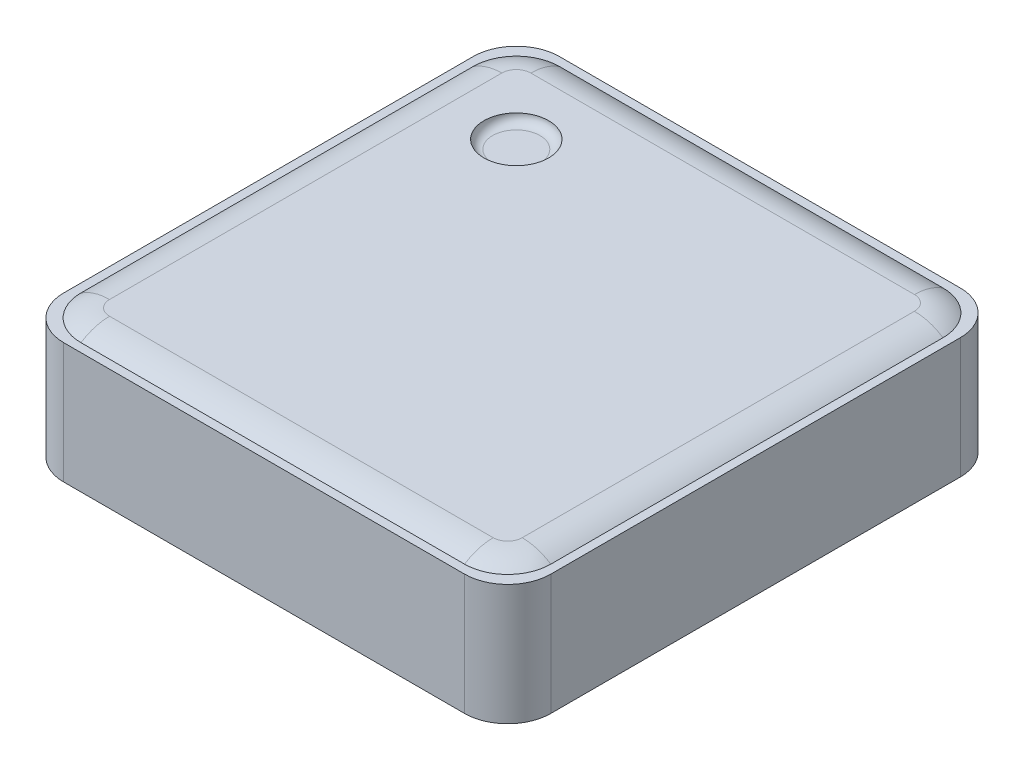
from build123d import *

# Parameters (mm, degrees)
ESBO_O1_W                = 113
ESBO_O1_H                = 115
RESSALTO_EXTRUS_O1_DEPTH = 30
ESBO_O2_W                = 113
ESBO_O2_H                = 115
ESBO_O2_W_2              = 109
ESBO_O2_H_2              = 111
CORTE_EXTRUS_O1_DEPTH    = 2
FILETE1_R                = 10
FILETE2_R                = 12
ESBO_O3_R                = 7.5
CORTE_EXTRUS_O2_DEPTH    = 2
FILETE3_R                = 2


# Some blends are built 0.0001 mm under size
with BuildPart() as part:
    # Esboço1 → Ressalto-extrusão1 (new body)
    with BuildSketch(Plane(origin=(0, 0, 0), x_dir=(1, 0, 0), z_dir=(0, 1, 0))):
        Rectangle(ESBO_O1_W, ESBO_O1_H)
    extrude(amount=RESSALTO_EXTRUS_O1_DEPTH)

    # Esboço2 → Corte-extrusão1 (cut)
    with BuildSketch(Plane(origin=(0, 30, 0), x_dir=(1, 0, 0), z_dir=(0, 1, 0))):
        Rectangle(ESBO_O2_W, ESBO_O2_H)
        Rectangle(ESBO_O2_W_2, ESBO_O2_H_2, mode=Mode.SUBTRACT)
    extrude(amount=-CORTE_EXTRUS_O1_DEPTH, mode=Mode.SUBTRACT)

    # Filete1
    filete1_edges = [part.edges().sort_by_distance(p)[0] for p in [
        (-56.5, 14, -57.5),
        (56.5, 14, -57.5),
        (56.5, 14, 57.5),
        (-56.5, 14, 57.5),
        (54.5, 29, 55.5),
        (-54.5, 29, 55.5),
        (-54.5, 29, -55.5),
        (54.5, 29, -55.5),
    ]]
    fillet(filete1_edges, radius=FILETE1_R)

    # Filete2
    # the kernel refuses this fillet: 12 mm, written as the material it takes off along each edge
    with BuildSketch(Plane(origin=(44.5, 30, 55.5), x_dir=(0, -1, 0), z_dir=(-1, 0, 0)), Plane(origin=(-44.5, 30, -55.5), x_dir=(0, -1, 0), z_dir=(1, 0, 0))) as filete2_piece_1:
        with BuildLine():
            CenterArc((12, -6.633249581), FILETE2_R, 146.442690238, 33.557309762)
            Line((0, -6.633249581), (-0.24, -6.633249581))
            Line((-0.24, -6.633249581), (-0.24, 0))
            Line((-0.24, 0), (0, 0.24))
            ThreePointArc((0, 0.24), (1, 0.24), (1.8, 0.132664992))
            Line((1.8, 0.132664992), (2, 0))
        make_face()
    extrude(amount=89, mode=Mode.SUBTRACT)
    with BuildSketch(Plane(origin=(-54.5, 30, 45.5), x_dir=(0, -1, 0), z_dir=(0, 0, -1)), Plane(origin=(54.5, 30, -45.5), x_dir=(0, -1, 0), z_dir=(0, 0, 1))) as filete2_piece_2:
        with BuildLine():
            CenterArc((12, -6.633249581), FILETE2_R, 146.442690238, 33.557309762)
            Line((0, -6.633249581), (-0.24, -6.633249581))
            Line((-0.24, -6.633249581), (-0.24, 0))
            Line((-0.24, 0), (0, 0.24))
            ThreePointArc((0, 0.24), (1, 0.24), (1.8, 0.132664992))
            Line((1.8, 0.132664992), (2, 0))
        make_face()
    extrude(amount=91, mode=Mode.SUBTRACT)
    with BuildSketch(Plane(origin=(44.5, 30, -45.5), x_dir=(1, 0, 0), z_dir=(0, 0, 1))) as filete2_piece_3:
        with BuildLine():
            CenterArc((3.366750419, -12), FILETE2_R, 56.442690238, 33.557309762)
            Line((3.366750419, 0), (3.366750419, 0.24))
            Line((3.366750419, 0.24), (10, 0.24))
            Line((10, 0.24), (10.24, 0))
            ThreePointArc((10.24, 0), (10.24, -1), (10.132664992, -1.8))
            Line((10.132664992, -1.8), (10, -2))
        make_face()
    revolve(axis=Axis((44.5, 30, -45.5), (0, 1, 0)), revolution_arc=90, mode=Mode.SUBTRACT)
    with BuildSketch(Plane(origin=(44.5, 30, 45.5), x_dir=(0, 0, 1), z_dir=(-1, 0, 0))) as filete2_piece_4:
        with BuildLine():
            CenterArc((3.366750419, -12), FILETE2_R, 56.442690238, 33.557309762)
            Line((3.366750419, 0), (3.366750419, 0.24))
            Line((3.366750419, 0.24), (10, 0.24))
            Line((10, 0.24), (10.24, 0))
            ThreePointArc((10.24, 0), (10.24, -1), (10.132664992, -1.8))
            Line((10.132664992, -1.8), (10, -2))
        make_face()
    revolve(axis=Axis((44.5, 30, 45.5), (0, 1, 0)), revolution_arc=90, mode=Mode.SUBTRACT)
    with BuildSketch(Plane(origin=(-44.5, 30, -45.5), x_dir=(-1, 0, 0), z_dir=(0, 0, 1))) as filete2_piece_5:
        with BuildLine():
            CenterArc((3.366750419, 12), FILETE2_R, 270, 33.557309762)
            Line((3.366750419, 0), (3.366750419, -0.24))
            Line((3.366750419, -0.24), (10, -0.24))
            Line((10, -0.24), (10.24, 0))
            ThreePointArc((10.24, 0), (10.24, 1), (10.132664992, 1.8))
            Line((10.132664992, 1.8), (10, 2))
        make_face()
    revolve(axis=Axis((-44.5, 30, -45.5), (0, -1, 0)), revolution_arc=90, mode=Mode.SUBTRACT)
    with BuildSketch(Plane(origin=(-44.5, 30, 45.5), x_dir=(-1, 0, 0), z_dir=(0, 0, -1))) as filete2_piece_6:
        with BuildLine():
            CenterArc((3.366750419, -12), FILETE2_R, 56.442690238, 33.557309762)
            Line((3.366750419, 0), (3.366750419, 0.24))
            Line((3.366750419, 0.24), (10, 0.24))
            Line((10, 0.24), (10.24, 0))
            ThreePointArc((10.24, 0), (10.24, -1), (10.132664992, -1.8))
            Line((10.132664992, -1.8), (10, -2))
        make_face()
    revolve(axis=Axis((-44.5, 30, 45.5), (0, 1, 0)), revolution_arc=90, mode=Mode.SUBTRACT)

    # Esboço3 → Corte-extrusão2 (cut)
    with BuildSketch(Plane(origin=(0, 30, 0), x_dir=(1, 0, 0), z_dir=(0, 1, 0))):
        with Locations(Location((-32.866750419, 33.866750419, 0), (0, 0, 270))):
            Circle(ESBO_O3_R)
    extrude(amount=-CORTE_EXTRUS_O2_DEPTH, mode=Mode.SUBTRACT)

    # Filete3
    filete3_edges = [part.edges().sort_by_distance(p)[0] for p in [
        (-32.866750419, 28, -41.366750419),
    ]]
    fillet(filete3_edges, radius=FILETE3_R - 0.0001)  # a hair under: the kernel refuses the full size


solid = part.part
